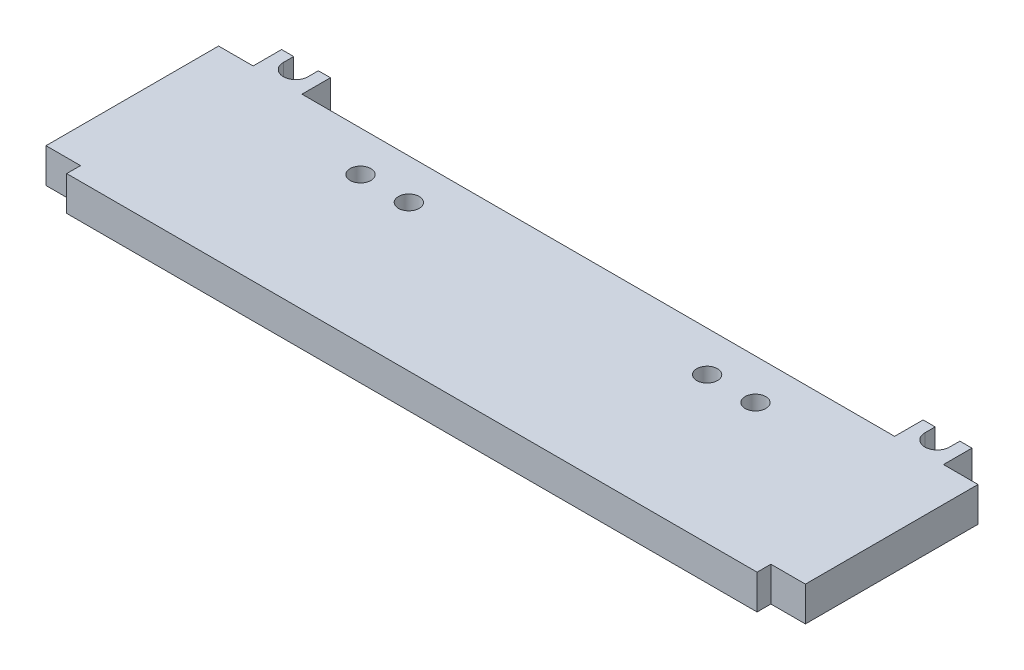
from build123d import *

# Parameters (mm, degrees)
SKETCH1_W                  = 27
SKETCH1_H                  = 5
BOSS_EXTRUDE1_DEPTH        = 110
M3_TAPPED_HOLE1_AT_2_COUNT = 2
M3_TAPPED_HOLE1_AT_2_PITCH = 7
SKETCH6_W                  = 5
SKETCH6_H                  = 2
CUT_EXTRUDE1_DEPTH         = 10
BOSS_EXTRUDE2_DEPTH        = 5


with BuildPart() as part:
    # Sketch1 → Boss-Extrude1 (new body)
    with BuildSketch(Plane(origin=(0, 0, 0), x_dir=(0, 0, -1), z_dir=(1, 0, 0))):
        with Locations((-3.636889684, 3.101965352)):
            Rectangle(SKETCH1_W, SKETCH1_H)
    extrude(amount=BOSS_EXTRUDE1_DEPTH)

    # Sketch14 → M3 Tapped Hole1 (revolve, cut)
    with BuildSketch(Plane(origin=(26.397029049, 5.601965352, -4.022332737), x_dir=(0, 0, 1), z_dir=(1, 0, 0))):
        Polygon((0, 0), (0, 8.251075774), (1.25, 7.5), (1.25, 6), (1.5, 6), (1.5, 0), align=None)
    m3_tapped_hole1 = revolve(axis=Axis((26.397029049, 11.951965352, -4.022332737), (0, -1, 0)), mode=Mode.SUBTRACT)

    # M3 Tapped Hole1 at 2: M3 Tapped Hole1 ×2
    with Locations(*[(i * M3_TAPPED_HOLE1_AT_2_PITCH, 0, 0) for i in range(1, M3_TAPPED_HOLE1_AT_2_COUNT)]):
        add(m3_tapped_hole1, mode=Mode.SUBTRACT)

    # Mirror3: M3 Tapped Hole1 across plane
    add(m3_tapped_hole1.mirror(Plane(origin=(55, 0, 0), x_dir=(0, 0, 1), z_dir=(1, 0, 0))), mode=Mode.SUBTRACT)

    # Mirror3 copy 1 sketch → Mirror3 copy 1 (revolve, cut)
    with BuildSketch(Plane(origin=(76.602970951, 5.601965352, -4.022332737), x_dir=(0, 0, 1), z_dir=(-1, 0, 0))):
        Polygon((0, 0), (0, -8.251075774), (1.25, -7.5), (1.25, -6), (1.5, -6), (1.5, 0), align=None)
    revolve(axis=Axis((76.602970951, 11.951965352, -4.022332737), (0, 1, 0)), mode=Mode.SUBTRACT)

    # Sketch6 → Cut-Extrude1 (cut)
    with BuildSketch(Plane(origin=(0, 5.601965352, 0), x_dir=(1, 0, 0), z_dir=(0, 1, 0))):
        with Locations((2.5, -16.136889684)):
            Rectangle(SKETCH6_W, SKETCH6_H)
    cut_extrude1 = extrude(amount=-CUT_EXTRUDE1_DEPTH, mode=Mode.SUBTRACT)

    # Mirror4: Cut-Extrude1 across plane
    add(cut_extrude1.mirror(Plane(origin=(55, 0, 0), x_dir=(0, 0, 1), z_dir=(1, 0, 0))), mode=Mode.SUBTRACT)

    # Sketch17 → Boss-Extrude2 (add)
    with BuildSketch(Plane(origin=(0, 5.601965352, 0), x_dir=(1, 0, 0), z_dir=(0, 1, 0))):
        with BuildLine():
            Line((105, 9.863110316), (105, 13.987127628))
            Line((105, 13.987127628), (103.25, 13.987127628))
            Line((103.25, 13.987127628), (103.25, 12.494266771))
            ThreePointArc((103.25, 12.494266771), (101.462023781, 10.706290552), (99.674047562, 12.494266771))
            Line((99.674047562, 12.494266771), (99.674047562, 13.987127628))
            Line((99.674047562, 13.987127628), (97.924047562, 13.987127628))
            Line((97.924047562, 13.987127628), (97.924047562, 9.863110316))
            Line((97.924047562, 9.863110316), (105, 9.863110316))
        make_face()
    boss_extrude2 = extrude(amount=-BOSS_EXTRUDE2_DEPTH)

    # Mirror5: Boss-Extrude2 across plane
    add(boss_extrude2.mirror(Plane.ZY.offset(-55)))


solid = part.part
